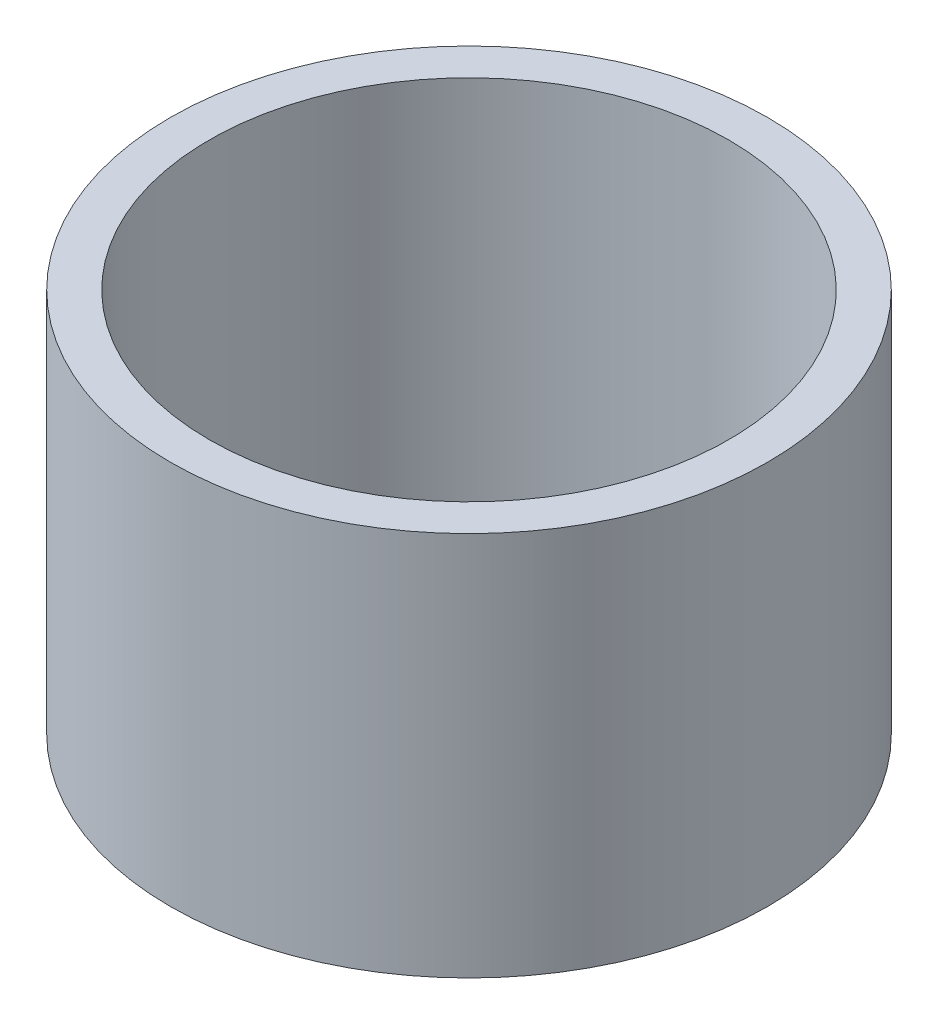
from build123d import *

# Parameters (mm, degrees)
SKETCH1_R           = 37.94599
BOSS_EXTRUDE1_DEPTH = 48.9
SKETCH2_R           = 33
CUT_EXTRUDE1_DEPTH  = 46.9
SKETCH3_R           = 15
BOSS_EXTRUDE2_DEPTH = 10


with BuildPart() as part:
    # Sketch1 → Boss-Extrude1 (new body)
    with BuildSketch(Plane(origin=(0, 0, 0), x_dir=(1, 0, 0), z_dir=(0, 1, 0))):
        Circle(SKETCH1_R)
    extrude(amount=BOSS_EXTRUDE1_DEPTH)

    # Sketch2 → Cut-Extrude1 (cut)
    with BuildSketch(Plane(origin=(0, 48.9, 0), x_dir=(1, 0, 0), z_dir=(0, 1, 0))):
        Circle(SKETCH2_R)
    extrude(amount=-CUT_EXTRUDE1_DEPTH, mode=Mode.SUBTRACT)

    # Sketch3 → Boss-Extrude2 (add)
    with BuildSketch(Plane.XZ):
        Circle(SKETCH3_R)
    extrude(amount=BOSS_EXTRUDE2_DEPTH)


solid = part.part
